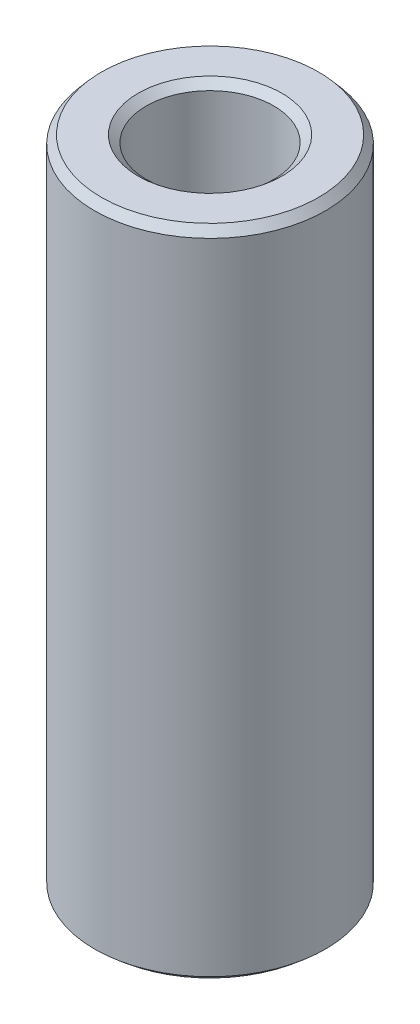
from build123d import *
from OCP.BRepFilletAPI import BRepFilletAPI_MakeChamfer

# Parameters (mm, degrees)
SKETCH1_R           = 42.5
BOSS_EXTRUDE1_DEPTH = 240.747035465
SKETCH2_R           = 23.447546307
CUT_EXTRUDE1_DEPTH  = 249.136323591
CHAMFER1_SIZE       = 2.997876151
CHAMFER1_SIZE2      = 2.542656529


with BuildPart() as part:
    # Sketch1 → Boss-Extrude1 (new body)
    with BuildSketch(Plane(origin=(0, 0, 0), x_dir=(1, 0, 0), z_dir=(0, 1, 0))):
        Circle(SKETCH1_R)
    extrude(amount=BOSS_EXTRUDE1_DEPTH)

    # Sketch2 → Cut-Extrude1 (cut, through all)
    with BuildSketch(Plane(origin=(0, 0, 0), x_dir=(1, 0, 0), z_dir=(0, 1, 0))):
        Circle(SKETCH2_R)
    extrude(amount=CUT_EXTRUDE1_DEPTH, mode=Mode.SUBTRACT)

    # Chamfer1: one chamfer whose edges measure the first distance from different faces: ONE call of the kernel's chamfer builder (chamfer() names one face for all edges)
    chamfer1_edges_1 = [part.edges().sort_by_distance(p)[0] for p in [
        (-23.447546307, 240.747035465, 0),
    ]]
    chamfer1_side_1 = [part.faces().sort_by_distance(p)[0] for p in [
        (-41.297918472, 240.747035465, 0),
    ]]
    chamfer1_edges_2 = [part.edges().sort_by_distance(p)[0] for p in [
        (-23.447546307, 0, 0),
    ]]
    chamfer1_side_2 = [part.faces().sort_by_distance(p)[0] for p in [
        (-23.447546307, 120.373517733, 0),
    ]]
    chamfer1_edges_3 = [part.edges().sort_by_distance(p)[0] for p in [
        (-42.5, 0, 0),
    ]]
    chamfer1_side_3 = [part.faces().sort_by_distance(p)[0] for p in [
        (-41.297918472, 0, 0),
    ]]
    chamfer1_edges_4 = [part.edges().sort_by_distance(p)[0] for p in [
        (-42.5, 240.747035465, 0),
    ]]
    chamfer1_side_4 = [part.faces().sort_by_distance(p)[0] for p in [
        (-42.5, 120.373517733, 0),
    ]]
    chamfer1 = BRepFilletAPI_MakeChamfer(part.part.solid().wrapped)
    for e in chamfer1_edges_1:
        chamfer1.Add(CHAMFER1_SIZE, CHAMFER1_SIZE2, e.wrapped, chamfer1_side_1[0].wrapped)  # the first distance lies on this face
    for e in chamfer1_edges_2:
        chamfer1.Add(CHAMFER1_SIZE, CHAMFER1_SIZE2, e.wrapped, chamfer1_side_2[0].wrapped)  # the first distance lies on this face
    for e in chamfer1_edges_3:
        chamfer1.Add(CHAMFER1_SIZE, CHAMFER1_SIZE2, e.wrapped, chamfer1_side_3[0].wrapped)  # the first distance lies on this face
    for e in chamfer1_edges_4:
        chamfer1.Add(CHAMFER1_SIZE, CHAMFER1_SIZE2, e.wrapped, chamfer1_side_4[0].wrapped)  # the first distance lies on this face
    add(Compound.cast(chamfer1.Shape()), mode=Mode.REPLACE)


solid = part.part
